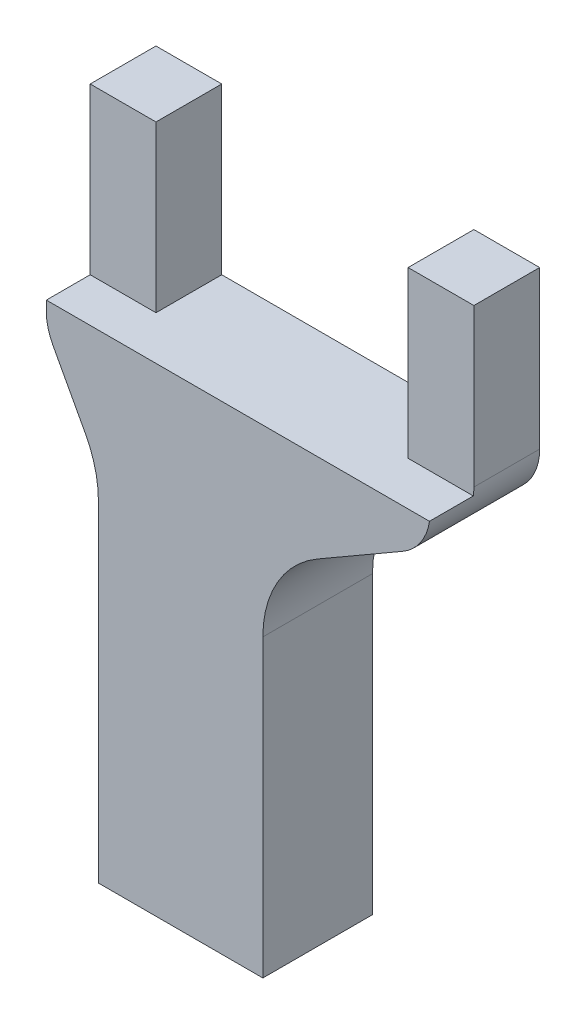
from build123d import *

# Parameters (mm, degrees)
BOSS_EXTRUDE1_DEPTH = 10
FILLET1_R           = 10
FILLET2_R           = 5
SKETCH2_W           = 35
SKETCH2_H           = 15.070963555
CUT_EXTRUDE1_DEPTH  = 4


with BuildPart() as part:
    # Sketch1 → Boss-Extrude1 (new body)
    with BuildSketch(Plane.XY):
        Polygon((-7.5, 467.320715151), (-7.5, 500.037974444), (-12.25, 508.842566049), (-12.25, 526.07117063), (-6.25, 526.07117063), (-6.25, 511.000207075), (16.75, 511.000207075), (16.75, 526.07117063), (22.75, 526.07117063), (22.75, 508.842566049), (7.5, 500.037974444), (7.5, 467.320715151), align=None)
    extrude(amount=BOSS_EXTRUDE1_DEPTH)

    # Fillet1
    fillet1_edges = [part.edges().sort_by_distance(p)[0] for p in [
        (-7.5, 500.037974444, 5),
        (7.5, 500.037974444, 5),
    ]]
    fillet(fillet1_edges, radius=FILLET1_R)

    # Fillet2
    fillet2_edges = [part.edges().sort_by_distance(p)[0] for p in [
        (-12.25, 508.842566049, 5),
        (22.75, 508.842566049, 5),
    ]]
    fillet(fillet2_edges, radius=FILLET2_R)

    # Sketch2 → Cut-Extrude1 (cut)
    with BuildSketch(Plane.XY.offset(10)):
        with Locations((5.25, 518.535688853)):
            Rectangle(SKETCH2_W, SKETCH2_H)
    extrude(amount=-CUT_EXTRUDE1_DEPTH, mode=Mode.SUBTRACT)


solid = part.part
